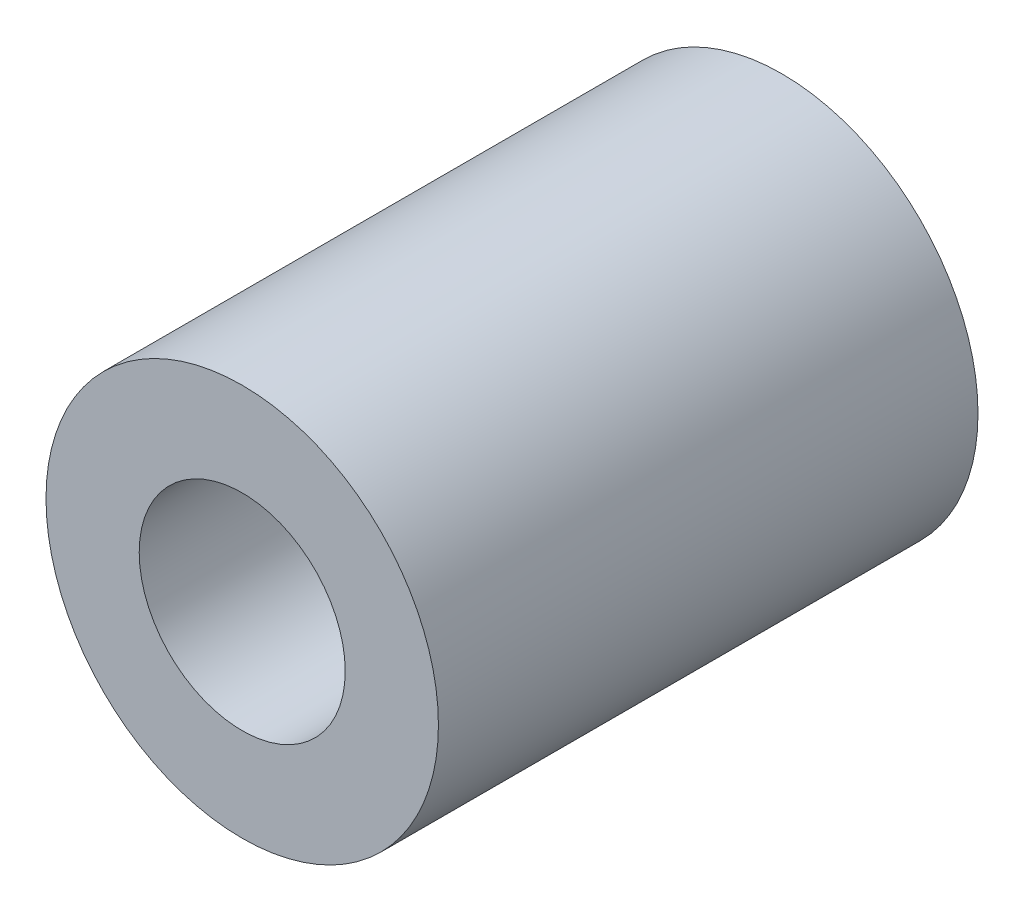
from build123d import *

# Parameters (mm, degrees)
SKETCH_1_R      = 4
SKETCH_1_R_2    = 2.1
EXTRUDE_1_DEPTH = 11


with BuildPart() as part:
    # ｽｹｯﾁ1 → ﾎﾞｽ - 押し出し1 (new body)
    with BuildSketch(Plane.XY):
        Circle(SKETCH_1_R)
        Circle(SKETCH_1_R_2, mode=Mode.SUBTRACT)
    extrude(amount=EXTRUDE_1_DEPTH)


solid = part.part
